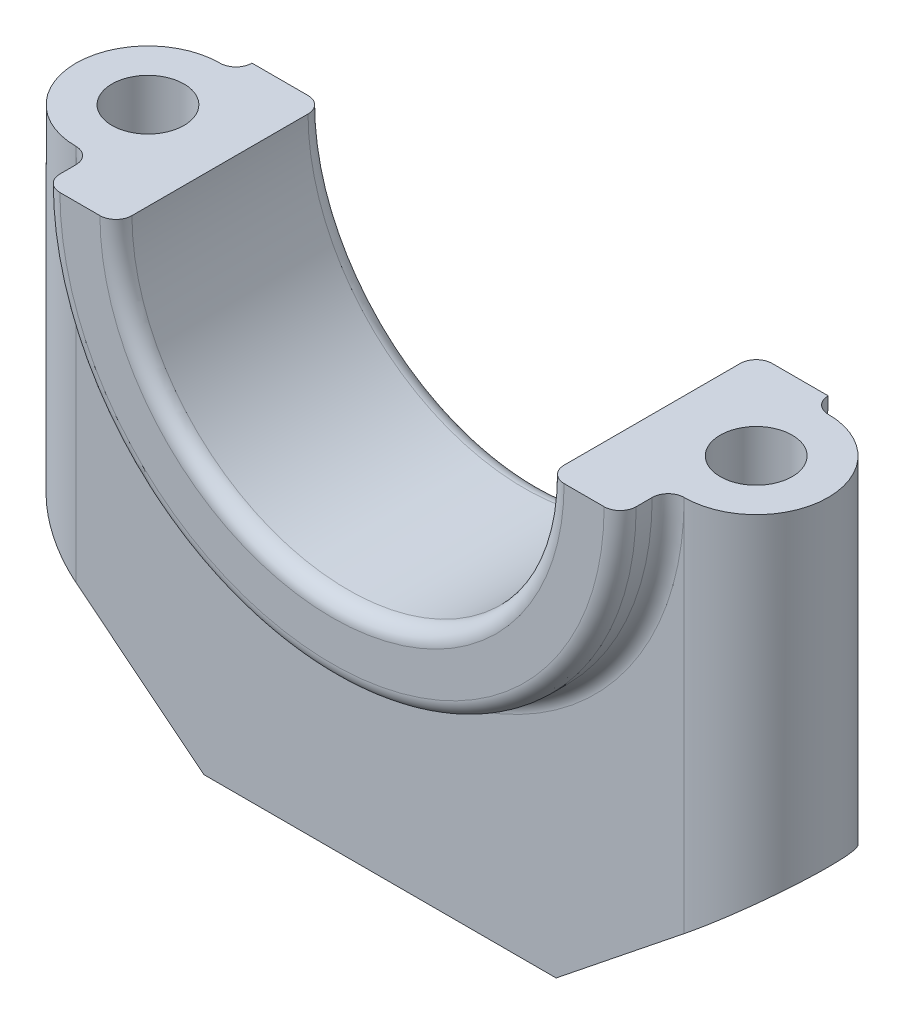
from build123d import *

# Parameters (mm, degrees)
BOSS_EXTRUDE1_DEPTH      = 15
BOSS_EXTRUDE1_DEPTH_BACK = 11
BOSS_EXTRUDE2_DEPTH      = 9
FILLET1_START            = -60
FILLET1_DEPTH            = 60
FILLET2_START            = -60
FILLET2_DEPTH            = 60
SKETCH2_R                = 4.5
CUT_EXTRUDE1_DEPTH       = 88
FILLET3_R                = 2
FILLET4_R                = 2


with BuildPart() as part:
    # Sketch1 → Boss-Extrude1 (new, two sides: drawn at the far end of the back side and taken through both)
    with BuildSketch(Plane.XY.offset(-BOSS_EXTRUDE1_DEPTH_BACK)):
        with BuildLine():
            Line((-27, 0), (-36, 0))
            ThreePointArc((-36, 0), (0, -36), (36, 0))
            Line((36, 0), (27, 0))
            ThreePointArc((27, 0), (0, -27), (-27, 0))
        make_face()
    extrude(amount=BOSS_EXTRUDE1_DEPTH + BOSS_EXTRUDE1_DEPTH_BACK)

    # Sketch1<3> → Boss-Extrude2 (add, symmetric)
    with BuildSketch(Plane.XY):
        with BuildLine():
            ThreePointArc((-36, 0), (0, -36), (36, 0))
            Line((36, 0), (47, 0))
            Line((47, 0), (47, -40))
            Line((47, -40), (22, -60))
            Line((22, -60), (-22, -60))
            Line((-22, -60), (-47, -40))
            Line((-47, -40), (-47, 0))
            Line((-47, 0), (-36, 0))
        make_face()
    extrude(amount=BOSS_EXTRUDE2_DEPTH, both=True)

    # Fillet1: read off the stored shape, not the designer's step
    # Fillet1 outline → Fillet1 (cut)
    with BuildSketch(Plane(origin=(0, 0, 0), x_dir=(1, 0, 0), z_dir=(0, 1, 0)).offset(FILLET1_START)):
        with BuildLine():
            Line((47, 9), (38, 9))
            ThreePointArc((38, 9), (44.363961031, 6.363961031), (47, 0))
            Line((47, 0), (47, 9))
        make_face()
        with BuildLine():
            Line((47, -9), (47, 0))
            ThreePointArc((47, 0), (44.363961031, -6.363961031), (38, -9))
            Line((38, -9), (47, -9))
        make_face()
    extrude(amount=FILLET1_DEPTH, mode=Mode.SUBTRACT)

    # Fillet2: read off the stored shape, not the designer's step
    # Fillet2 outline → Fillet2 (cut)
    with BuildSketch(Plane(origin=(0, 0, 0), x_dir=(1, 0, 0), z_dir=(0, 1, 0)).offset(FILLET2_START)):
        with BuildLine():
            Line((-47, -9), (-38, -9))
            ThreePointArc((-38, -9), (-44.363961031, -6.363961031), (-47, 0))
            Line((-47, 0), (-47, -9))
        make_face()
        with BuildLine():
            Line((-47, 9), (-47, 0))
            ThreePointArc((-47, 0), (-44.363961031, 6.363961031), (-38, 9))
            Line((-38, 9), (-47, 9))
        make_face()
    extrude(amount=FILLET2_DEPTH, mode=Mode.SUBTRACT)

    # Sketch2 → Cut-Extrude1 (cut)
    with BuildSketch(Plane(origin=(0, 0, 0), x_dir=(1, 0, 0), z_dir=(0, 1, 0))):
        with Locations(Location((38, 0, 0), (0, 0, 270))):
            Circle(SKETCH2_R)
        with Locations(Location((-38, 0, 0), (0, 0, 180))):
            Circle(SKETCH2_R)
    extrude(amount=-CUT_EXTRUDE1_DEPTH, mode=Mode.SUBTRACT)

    # Fillet3
    fillet3_edges = [part.edges().sort_by_distance(p)[0] for p in [
        (0, -36, 15),
        (0, -36, -9),
        (0, -36, 9),
    ]]
    fillet(fillet3_edges, radius=FILLET3_R - 0.0001)  # a hair under: the kernel refuses the full size

    # Fillet4
    fillet4_edges = [part.edges().sort_by_distance(p)[0] for p in [
        (0, -27, 15),
        (0, -27, -11),
    ]]
    fillet(fillet4_edges, radius=FILLET4_R)


solid = part.part
